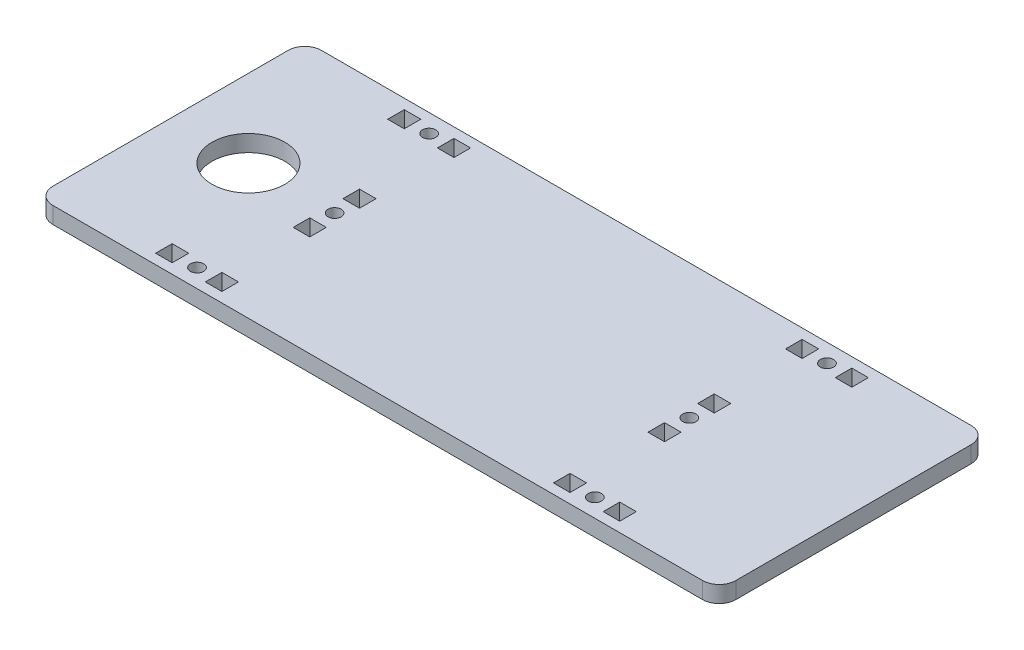
from build123d import *

# Parameters (mm, degrees)
SKETCH1_W           = 206
SKETCH1_H           = 81
SKETCH1_R           = 2
SKETCH1_R_2         = 11
SKETCH1_W_2         = 5
SKETCH1_H_2         = 5
BOSS_EXTRUDE4_DEPTH = 5
FILLET9_R           = 5


with BuildPart() as part:
    # Sketch1 → Boss-Extrude4 (new body)
    with BuildSketch(Plane(origin=(0, 0, 0), x_dir=(1, 0, 0), z_dir=(0, 1, 0))):
        with Locations((5.102707087, 13.156325227)):
            Rectangle(SKETCH1_W, SKETCH1_H)
        with Locations((-54.897292913, 48.156325227)):
            Circle(SKETCH1_R, mode=Mode.SUBTRACT)
        with Locations((-54.897292913, -21.843674773)):
            Circle(SKETCH1_R, mode=Mode.SUBTRACT)
        with Locations((65.102707087, -21.843674773)):
            Circle(SKETCH1_R, mode=Mode.SUBTRACT)
        with Locations((65.102707087, 48.156325227)):
            Circle(SKETCH1_R, mode=Mode.SUBTRACT)
        with Locations((-48.397292913, 13.156325227)):
            Circle(SKETCH1_R, mode=Mode.SUBTRACT)
        with Locations((58.602707087, 13.156325227)):
            Circle(SKETCH1_R, mode=Mode.SUBTRACT)
        with Locations((-74.397292913, 13.156325227)):
            Circle(SKETCH1_R_2, mode=Mode.SUBTRACT)
        with Locations((57.602707087, 48.156325227)):
            Rectangle(SKETCH1_W_2, SKETCH1_H_2, mode=Mode.SUBTRACT)
        with Locations((-62.397292913, 48.156325227)):
            Rectangle(SKETCH1_W_2, SKETCH1_H_2, mode=Mode.SUBTRACT)
        with Locations((-47.397292913, 48.156325227)):
            Rectangle(SKETCH1_W_2, SKETCH1_H_2, mode=Mode.SUBTRACT)
        with Locations((72.602707087, 48.156325227)):
            Rectangle(SKETCH1_W_2, SKETCH1_H_2, mode=Mode.SUBTRACT)
        with Locations((72.602707087, -21.843674773)):
            Rectangle(SKETCH1_W_2, SKETCH1_H_2, mode=Mode.SUBTRACT)
        with Locations((57.602707087, -21.843674773)):
            Rectangle(SKETCH1_W_2, SKETCH1_H_2, mode=Mode.SUBTRACT)
        with Locations((-47.397292913, -21.843674773)):
            Rectangle(SKETCH1_W_2, SKETCH1_H_2, mode=Mode.SUBTRACT)
        with Locations((-62.397292913, -21.843674773)):
            Rectangle(SKETCH1_W_2, SKETCH1_H_2, mode=Mode.SUBTRACT)
        with Locations((-48.397292913, 20.656325227)):
            Rectangle(SKETCH1_W_2, SKETCH1_H_2, mode=Mode.SUBTRACT)
        with Locations((-48.397292913, 5.656325227)):
            Rectangle(SKETCH1_W_2, SKETCH1_H_2, mode=Mode.SUBTRACT)
        with Locations((58.602707087, 5.656325227)):
            Rectangle(SKETCH1_W_2, SKETCH1_H_2, mode=Mode.SUBTRACT)
        with Locations((58.602707087, 20.656325227)):
            Rectangle(SKETCH1_W_2, SKETCH1_H_2, mode=Mode.SUBTRACT)
    extrude(amount=BOSS_EXTRUDE4_DEPTH)

    # Fillet9
    fillet9_edges = [part.edges().sort_by_distance(p)[0] for p in [
        (108.102707087, 2.5, -53.656325227),
        (108.102707087, 2.5, 27.343674773),
        (-97.897292913, 2.5, -53.656325227),
        (-97.897292913, 2.5, 27.343674773),
    ]]
    fillet(fillet9_edges, radius=FILLET9_R)


solid = part.part
